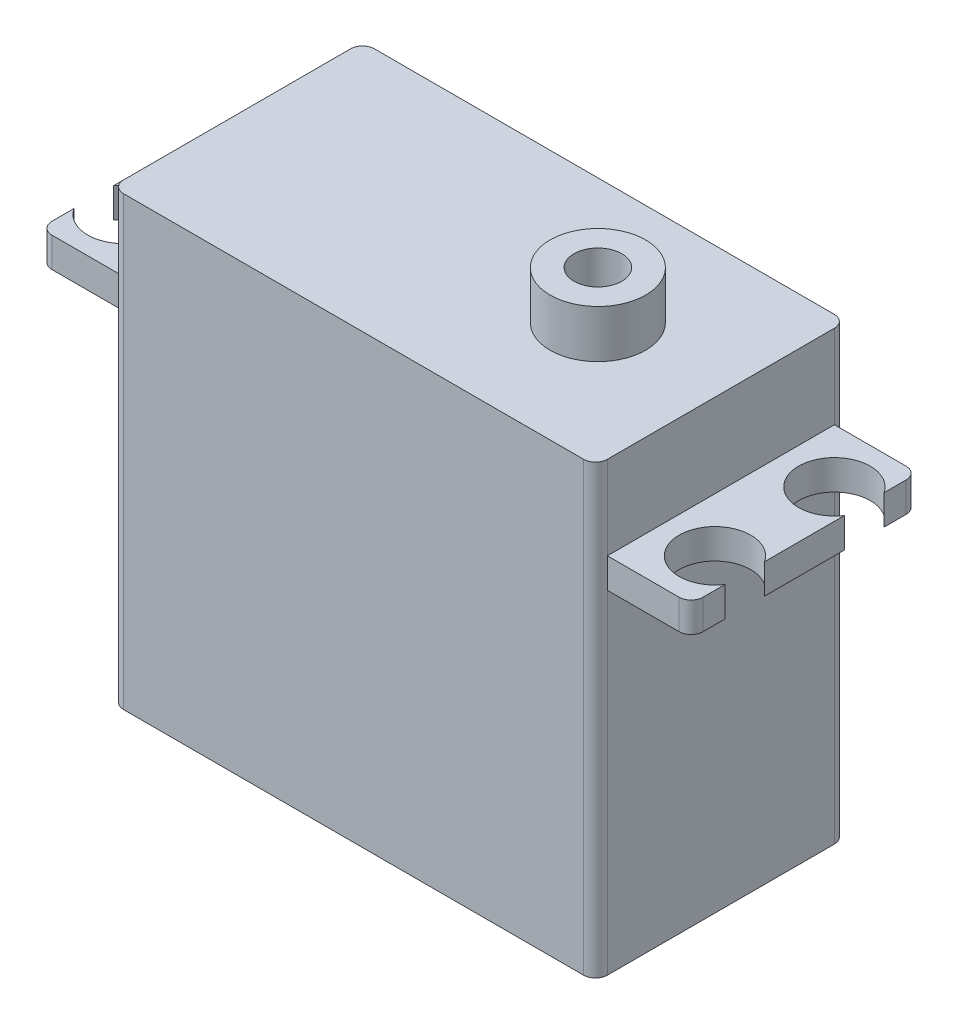
from build123d import *

# Parameters (mm, degrees)
SKETCH_1_W          = 40.5
SKETCH_1_H          = 21
EXTRUDE_1_DEPTH     = 30.4
SKETCH_2_W          = 19
SKETCH_2_H          = 2.5
EXTRUDE_2_DEPTH     = 7
SKETCH_3_W          = 40.5
SKETCH_3_H          = 21
EXTRUDE_3_DEPTH     = 7
SKETCH_4_R          = 3
CUT_EXTRUDE_1_DEPTH = 7
SKETCH_5_R          = 4
SKETCH_5_R_2        = 2
EXTRUDE_4_DEPTH     = 4
FILLET_1_R          = 1
FILLET_2_R          = 1
FILLET_3_R          = 1
FILLET_4_R          = 1
FILLET_5_R          = 1
FILLET_6_R          = 1
FILLET_7_R          = 1
FILLET_8_R          = 1


with BuildPart() as part:
    # 草图1 → 凸台-拉伸1 (new body)
    with BuildSketch(Plane(origin=(0, 0, 0), x_dir=(1, 0, 0), z_dir=(0, 1, 0))):
        Rectangle(SKETCH_1_W, SKETCH_1_H)
    extrude(amount=EXTRUDE_1_DEPTH)

    # 草图2 → 凸台-拉伸2 (add)
    with BuildSketch(Plane(origin=(20.25, 0, 0), x_dir=(0, 0, -1), z_dir=(1, 0, 0))):
        with Locations((0, 29.15)):
            Rectangle(SKETCH_2_W, SKETCH_2_H)
    extrude_2 = extrude(amount=EXTRUDE_2_DEPTH)

    # 草图3 → 凸台-拉伸3 (add)
    with BuildSketch(Plane(origin=(0, 30.4, 0), x_dir=(1, 0, 0), z_dir=(0, 1, 0))):
        Rectangle(SKETCH_3_W, SKETCH_3_H)
    extrude(amount=EXTRUDE_3_DEPTH)

    # 草图4 → 切除-拉伸1 (cut)
    with BuildSketch(Plane(origin=(0, 30.4, 0), x_dir=(1, 0, 0), z_dir=(0, 1, 0))):
        with Locations((24.75, 5)):
            Circle(SKETCH_4_R)
        with Locations((24.75, -5)):
            Circle(SKETCH_4_R)
    cut_extrude_1 = extrude(amount=-CUT_EXTRUDE_1_DEPTH, mode=Mode.SUBTRACT)

    # 草图5 → 凸台-拉伸4 (add)
    with BuildSketch(Plane(origin=(0, 37.4, 0), x_dir=(1, 0, 0), z_dir=(0, 1, 0))):
        with Locations(Location((9.95, 0, 0), (0, 0, 270))):
            Circle(SKETCH_5_R)
        with Locations(Location((9.95, 0, 0), (0, 0, 270))):
            Circle(SKETCH_5_R_2, mode=Mode.SUBTRACT)
    extrude(amount=EXTRUDE_4_DEPTH)

    # 镜向2: 凸台-拉伸2, 切除-拉伸1 across plane
    add(extrude_2.mirror(Plane(origin=(0, 0, 0), x_dir=(0, 0, 1), z_dir=(1, 0, 0))))
    add(cut_extrude_1.mirror(Plane(origin=(0, 0, 0), x_dir=(0, 0, 1), z_dir=(1, 0, 0))), mode=Mode.SUBTRACT)

    # 圆角1
    fillet_1_edges = [part.edges().sort_by_distance(p)[0] for p in [
        (20.25, 18.7, -10.5),
    ]]
    fillet(fillet_1_edges, radius=FILLET_1_R - 0.0001)  # a hair under: the kernel refuses the full size

    # 圆角2
    fillet_2_edges = [part.edges().sort_by_distance(p)[0] for p in [
        (20.25, 18.7, 10.5),
    ]]
    fillet(fillet_2_edges, radius=FILLET_2_R - 0.0001)  # a hair under: the kernel refuses the full size

    # 圆角3
    fillet_3_edges = [part.edges().sort_by_distance(p)[0] for p in [
        (-20.25, 18.7, 10.5),
    ]]
    fillet(fillet_3_edges, radius=FILLET_3_R - 0.0001)  # a hair under: the kernel refuses the full size

    # 圆角4
    fillet_4_edges = [part.edges().sort_by_distance(p)[0] for p in [
        (-20.25, 18.7, -10.5),
    ]]
    fillet(fillet_4_edges, radius=FILLET_4_R - 0.0001)  # a hair under: the kernel refuses the full size

    # 圆角5
    fillet_5_edges = [part.edges().sort_by_distance(p)[0] for p in [
        (-27.25, 29.15, -9.5),
    ]]
    fillet(fillet_5_edges, radius=FILLET_5_R)

    # 圆角6
    fillet_6_edges = [part.edges().sort_by_distance(p)[0] for p in [
        (-27.25, 29.15, 9.5),
    ]]
    fillet(fillet_6_edges, radius=FILLET_6_R)

    # 圆角7
    fillet_7_edges = [part.edges().sort_by_distance(p)[0] for p in [
        (27.25, 29.15, 9.5),
    ]]
    fillet(fillet_7_edges, radius=FILLET_7_R)

    # 圆角8
    fillet_8_edges = [part.edges().sort_by_distance(p)[0] for p in [
        (27.25, 29.15, -9.5),
    ]]
    fillet(fillet_8_edges, radius=FILLET_8_R)


solid = part.part
